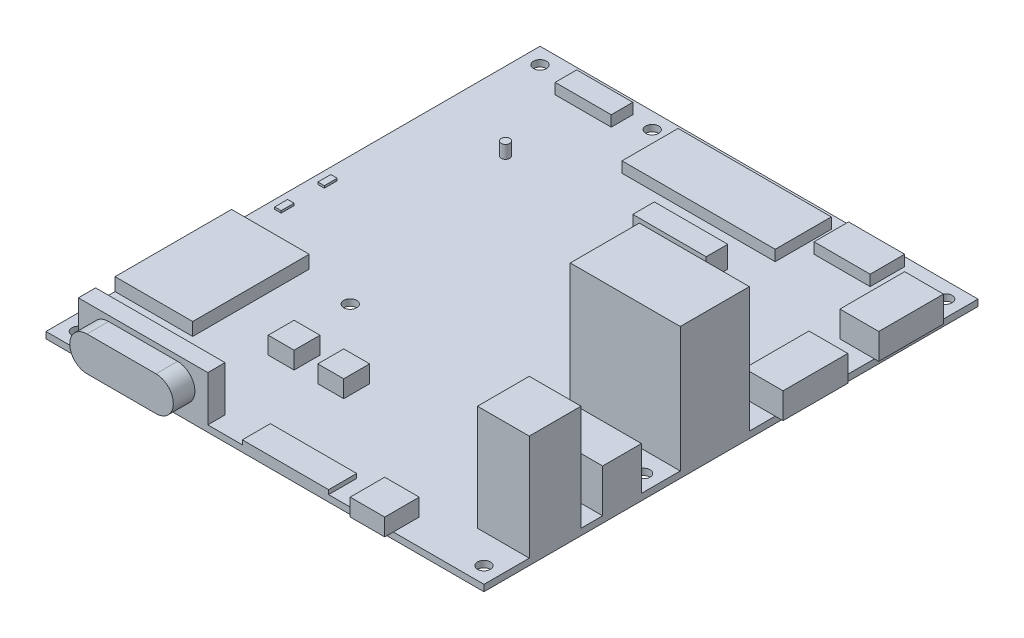
from build123d import *

# Parameters (mm, degrees)
SKETCH1_W                  = 101.5
SKETCH1_H                  = 114.5
TR_KKPLAAT_DEPTH           = 1.5
SKETCH2_R                  = 1.5
AUGUD_DEPTH                = 1.5
SKETCH3_W                  = 35.5
SKETCH3_H                  = 13
EXP_CONN_A_B_DEPTH         = 2.5
SKETCH4_W                  = 13
SKETCH4_H                  = 8
LCD_CONN_A_B_DEPTH         = 2.5
SKETCH5_W                  = 13
SKETCH5_H                  = 5
WIFI_BT_DEPTH              = 2.5
SKETCH6_W                  = 17
SKETCH6_H                  = 5
JTAG_DEPTH                 = 5
SKETCH7_W                  = 9
SKETCH7_H                  = 15
HDMI_A_B_DEPTH             = 6
SKETCH8_W                  = 25.5
SKETCH8_H                  = 16
USB_ETHERNET_DEPTH         = 29
SKETCH9_W                  = 14
SKETCH9_H                  = 9
F_5V_IN_DEPTH              = 10
SKETCH10_W                 = 12
SKETCH10_H                 = 12
HEADPHONE_DEPTH            = 24.5
SKETCH11_W                 = 8
SKETCH11_H                 = 8
MINI_USB_DEPTH             = 4
SKETCH12_W                 = 30
SKETCH12_H                 = 4
BOSS_EXTRUDE11_DEPTH       = 10.5
BOSS_EXTRUDE12_DEPTH       = 5
SKETCH14_W                 = 18
SKETCH14_H                 = 27
SD_CARD_SLOT_DEPTH         = 3
SKETCH15_W                 = 1.5
SKETCH15_H                 = 3
STATUS_LED_DEPTH           = 0.5
SKETCH16_W                 = 6
SKETCH16_H                 = 6
PWRON_RESET_GPIO_121_DEPTH = 4
SKETCH17_W                 = 20
SKETCH17_H                 = 6.5
CAMERA_CONN_DEPTH          = 1
SKETCH18_R                 = 1
WIFI_BT_ANTENNA_DEPTH      = 3


with BuildPart() as part:
    # Sketch1 → trükkplaat (new body)
    with BuildSketch(Plane(origin=(0, 0, 0), x_dir=(1, 0, 0), z_dir=(0, 1, 0))):
        Rectangle(SKETCH1_W, SKETCH1_H)
    extrude(amount=TR_KKPLAAT_DEPTH)

    # Sketch2 → augud (cut)
    with BuildSketch(Plane(origin=(0, 1.5, 0), x_dir=(1, 0, 0), z_dir=(0, 1, 0))):
        with Locations((-47, 53.5)):
            Circle(SKETCH2_R)
        with Locations((47, 53.5)):
            Circle(SKETCH2_R)
        with Locations((47, -53.5)):
            Circle(SKETCH2_R)
        with Locations((-47, -53.5)):
            Circle(SKETCH2_R)
        with Locations((-21, 53.5)):
            Circle(SKETCH2_R)
        with Locations((-21, -16.5)):
            Circle(SKETCH2_R)
        with Locations((47, -16.5)):
            Circle(SKETCH2_R)
    extrude(amount=-AUGUD_DEPTH, mode=Mode.SUBTRACT)

    # Sketch3 → exp. conn. A/B (add)
    with BuildSketch(Plane(origin=(0, 1.5, 0), x_dir=(1, 0, 0), z_dir=(0, 1, 0))):
        with Locations((2, 47.75)):
            Rectangle(SKETCH3_W, SKETCH3_H)
    extrude(amount=EXP_CONN_A_B_DEPTH)

    # Sketch4 → LCD conn. A/B (add)
    with BuildSketch(Plane(origin=(0, 1.5, 0), x_dir=(1, 0, 0), z_dir=(0, 1, 0))):
        with Locations((29.25, 51.25)):
            Rectangle(SKETCH4_W, SKETCH4_H)
    extrude(amount=LCD_CONN_A_B_DEPTH)

    # Sketch5 → WIFI/BT (add)
    with BuildSketch(Plane(origin=(0, 1.5, 0), x_dir=(1, 0, 0), z_dir=(0, 1, 0))):
        with Locations((-32.75, 51.75)):
            Rectangle(SKETCH5_W, SKETCH5_H)
    extrude(amount=WIFI_BT_DEPTH)

    # Sketch6 → JTAG (add)
    with BuildSketch(Plane(origin=(0, 1.5, 0), x_dir=(1, 0, 0), z_dir=(0, 1, 0))):
        with Locations((7.25, 31.75)):
            Rectangle(SKETCH6_W, SKETCH6_H)
    extrude(amount=JTAG_DEPTH)

    # Sketch7 → HDMI A/B (add)
    with BuildSketch(Plane(origin=(0, 1.5, 0), x_dir=(1, 0, 0), z_dir=(0, 1, 0))):
        with Locations((47.25, 40.75)):
            Rectangle(SKETCH7_W, SKETCH7_H)
        with Locations((48.068861521, 17.75)):
            Rectangle(SKETCH7_W, SKETCH7_H)
    extrude(amount=HDMI_A_B_DEPTH)

    # Sketch8 → USB/Ethernet (add)
    with BuildSketch(Plane(origin=(0, 1.5, 0), x_dir=(1, 0, 0), z_dir=(0, 1, 0))):
        with Locations((38, -3.75)):
            Rectangle(SKETCH8_W, SKETCH8_H)
    extrude(amount=USB_ETHERNET_DEPTH)

    # Sketch9 → 5V in (add)
    with BuildSketch(Plane(origin=(0, 1.5, 0), x_dir=(1, 0, 0), z_dir=(0, 1, 0))):
        with Locations((43.75, -25.25)):
            Rectangle(SKETCH9_W, SKETCH9_H)
    extrude(amount=F_5V_IN_DEPTH)

    # Sketch10 → Headphone (add)
    with BuildSketch(Plane(origin=(0, 1.5, 0), x_dir=(1, 0, 0), z_dir=(0, 1, 0))):
        with Locations((44.75, -40.75)):
            Rectangle(SKETCH10_W, SKETCH10_H)
    extrude(amount=HEADPHONE_DEPTH)

    # Sketch11 → mini-USB (add)
    with BuildSketch(Plane(origin=(0, 1.5, 0), x_dir=(1, 0, 0), z_dir=(0, 1, 0))):
        with Locations((25.75, -55.25)):
            Rectangle(SKETCH11_W, SKETCH11_H)
    extrude(amount=MINI_USB_DEPTH)

    # Sketch12 → Boss-Extrude11 (add)
    with BuildSketch(Plane(origin=(0, 1.5, 0), x_dir=(1, 0, 0), z_dir=(0, 1, 0))):
        with Locations((-28.25, -55.25)):
            Rectangle(SKETCH12_W, SKETCH12_H)
    extrude(amount=BOSS_EXTRUDE11_DEPTH)

    # Sketch13 → Boss-Extrude12 (add)
    with BuildSketch(Plane.XY.offset(57.25)):
        with BuildLine():
            Line((-36.25, 10.75), (-20.25, 10.75))
            ThreePointArc((-20.25, 10.75), (-16.25, 6.75), (-20.25, 2.75))
            Line((-20.25, 2.75), (-36.25, 2.75))
            ThreePointArc((-36.25, 2.75), (-40.25, 6.75), (-36.25, 10.75))
        make_face()
    extrude(amount=BOSS_EXTRUDE12_DEPTH)

    # Sketch14 → SD-card slot (add)
    with BuildSketch(Plane(origin=(0, 1.5, 0), x_dir=(1, 0, 0), z_dir=(0, 1, 0))):
        with Locations((-41.75, -27.75)):
            Rectangle(SKETCH14_W, SKETCH14_H)
    extrude(amount=SD_CARD_SLOT_DEPTH)

    # Sketch15 → status LED (add)
    with BuildSketch(Plane(origin=(0, 1.5, 0), x_dir=(1, 0, 0), z_dir=(0, 1, 0))):
        with Locations((-48, -4.75)):
            Rectangle(SKETCH15_W, SKETCH15_H)
        with Locations((-48, 5.25)):
            Rectangle(SKETCH15_W, SKETCH15_H)
    extrude(amount=STATUS_LED_DEPTH)

    # Sketch16 → PWRON_RESET/GPIO_121 (add)
    with BuildSketch(Plane(origin=(0, 1.5, 0), x_dir=(1, 0, 0), z_dir=(0, 1, 0))):
        with Locations((-5.75, -33.25)):
            Rectangle(SKETCH16_W, SKETCH16_H)
        with Locations((-17.25, -33.25)):
            Rectangle(SKETCH16_W, SKETCH16_H)
    extrude(amount=PWRON_RESET_GPIO_121_DEPTH)

    # Sketch17 → camera conn (add)
    with BuildSketch(Plane(origin=(0, 1.5, 0), x_dir=(1, 0, 0), z_dir=(0, 1, 0))):
        with Locations((4.75, -54)):
            Rectangle(SKETCH17_W, SKETCH17_H)
    extrude(amount=CAMERA_CONN_DEPTH)

    # Sketch18 → WIFI?/BT? antenna (add)
    with BuildSketch(Plane(origin=(0, 1.5, 0), x_dir=(1, 0, 0), z_dir=(0, 1, 0))):
        with Locations((-32.75, 31.25)):
            Circle(SKETCH18_R)
    extrude(amount=WIFI_BT_ANTENNA_DEPTH)


solid = part.part
